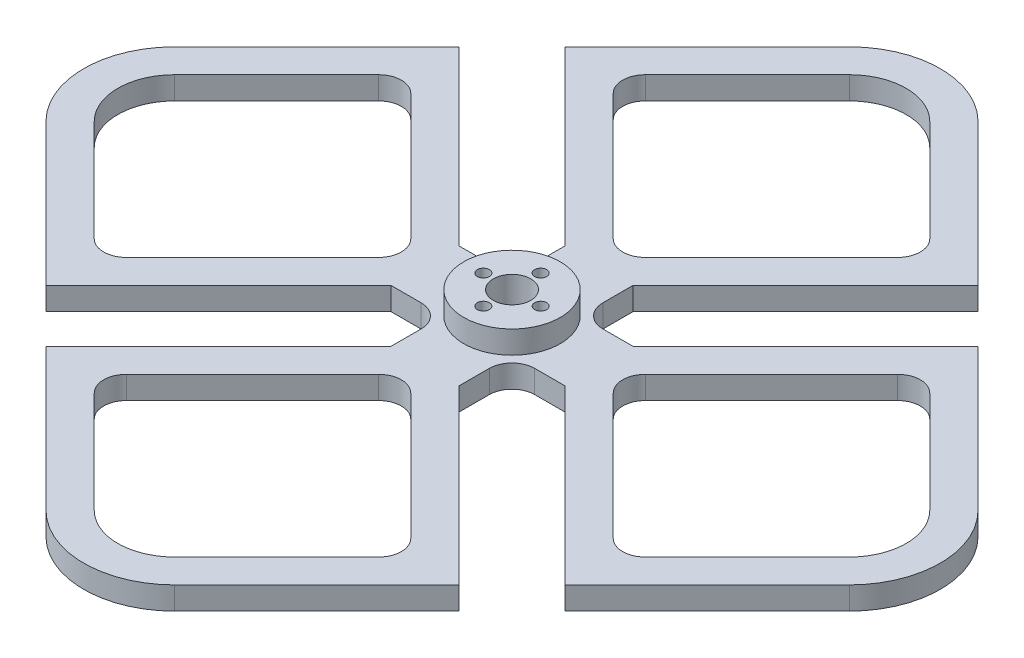
from build123d import *

# Parameters (mm, degrees)
BOSS_EXTRUDE5_DEPTH      = 6.35
FILLET1_R                = 25.4
CUT_EXTRUDE3_DEPTH       = 133.905327416
CIRPATTERN7_COUNT        = 4
FILLET1_OF_CIRPATTERN7_R = 25.4
SKETCH13_R               = 13.470384182
BOSS_EXTRUDE8_DEPTH      = 6.35
SKETCH1_R                = 5.22699996
SKETCH1_R_2              = 1.686500056
CUT_EXTRUDE1_DEPTH       = 170.589221223
FILLET2_R                = 6.35


with BuildPart() as part:
    # Sketch4 → Boss-Extrude5 (new body)
    with BuildSketch(Plane(origin=(0, 0, 0), x_dir=(1, 0, 0), z_dir=(0, 1, 0))):
        Polygon((24.3205, 9.525), (0, 9.525), (0, -9.525), (24.3205, -9.525), (72.448744297, -57.653244297), (130.101988595, 0), (72.448744297, 57.653244297), align=None)
    boss_extrude5 = extrude(amount=BOSS_EXTRUDE5_DEPTH)

    # Fillet1
    fillet1_edges = [part.edges().sort_by_distance(p)[0] for p in [
        (130.101988595, 3.175, 0),
    ]]
    fillet(fillet1_edges, radius=FILLET1_R)

    # Sketch12 → Cut-Extrude3 (cut, through all)
    with BuildSketch(Plane(origin=(0, 6.35, 0), x_dir=(1, 0, 0), z_dir=(0, 1, 0))):
        with BuildLine():
            Line((72.448744297, -44.182860116), (105.406284262, -11.225320151))
            ThreePointArc((105.406284262, -11.225320151), (110.05596411, 0), (105.406284262, 11.225320151))
            Line((105.406284262, 11.225320151), (72.448744297, 44.182860116))
            Line((72.448744297, 44.182860116), (28.265884182, 0))
            Line((28.265884182, 0), (72.448744297, -44.182860116))
        make_face()
    cut_extrude3 = extrude(amount=-CUT_EXTRUDE3_DEPTH, mode=Mode.SUBTRACT)

    # CirPattern7: Boss-Extrude5, Cut-Extrude3 ×4 about axis
    cirpattern7_axis = Axis((0, 0, 0), (0, 1, 0))
    add([boss_extrude5.rotate(cirpattern7_axis, i * 360 / CIRPATTERN7_COUNT) for i in range(1, CIRPATTERN7_COUNT)])
    add([cut_extrude3.rotate(cirpattern7_axis, i * 360 / CIRPATTERN7_COUNT) for i in range(1, CIRPATTERN7_COUNT)], mode=Mode.SUBTRACT)

    # Fillet1 of CirPattern7
    fillet1_of_cirpattern7_edges = [part.edges().sort_by_distance(p)[0] for p in [
        (0, 3.175, -130.101988595),
        (-130.101988595, 3.175, 0),
        (0, 3.175, 130.101988595),
    ]]
    fillet(fillet1_of_cirpattern7_edges, radius=FILLET1_OF_CIRPATTERN7_R)

    # Sketch13 → Boss-Extrude8 (add)
    with BuildSketch(Plane(origin=(0, 6.35, 0), x_dir=(1, 0, 0), z_dir=(0, 1, 0))):
        Circle(SKETCH13_R)
    extrude(amount=BOSS_EXTRUDE8_DEPTH)

    # Sketch1 → Cut-Extrude1 (cut, through all)
    with BuildSketch(Plane(origin=(0, 0, 0), x_dir=(1, 0, 0), z_dir=(0, 1, 0))):
        Circle(SKETCH1_R)
        with Locations((8.000000002, 0)):
            Circle(SKETCH1_R_2)
        with Locations((0, -8.000000002)):
            Circle(SKETCH1_R_2)
        with Locations((-8.000000002, 0)):
            Circle(SKETCH1_R_2)
        with Locations((0, 8.000000002)):
            Circle(SKETCH1_R_2)
    extrude(amount=CUT_EXTRUDE1_DEPTH, mode=Mode.SUBTRACT)

    # Fillet2
    fillet2_edges = [part.edges().sort_by_distance(p)[0] for p in [
        (-72.448744297, 3.175, 44.182860116),
        (-72.448744297, 3.175, -44.182860116),
        (-28.265884182, 3.175, 0),
        (-44.182860116, 3.175, -72.448744297),
        (44.182860116, 3.175, -72.448744297),
        (0, 3.175, -28.265884182),
        (72.448744297, 3.175, -44.182860116),
        (72.448744297, 3.175, 44.182860116),
        (28.265884182, 3.175, 0),
        (44.182860116, 3.175, 72.448744297),
        (-44.182860116, 3.175, 72.448744297),
        (0, 3.175, 28.265884182),
        (9.525, 3.175, -9.525),
        (-9.525, 3.175, -9.525),
        (-9.525, 3.175, 9.525),
        (9.525, 3.175, 9.525),
    ]]
    fillet(fillet2_edges, radius=FILLET2_R)


solid = part.part
